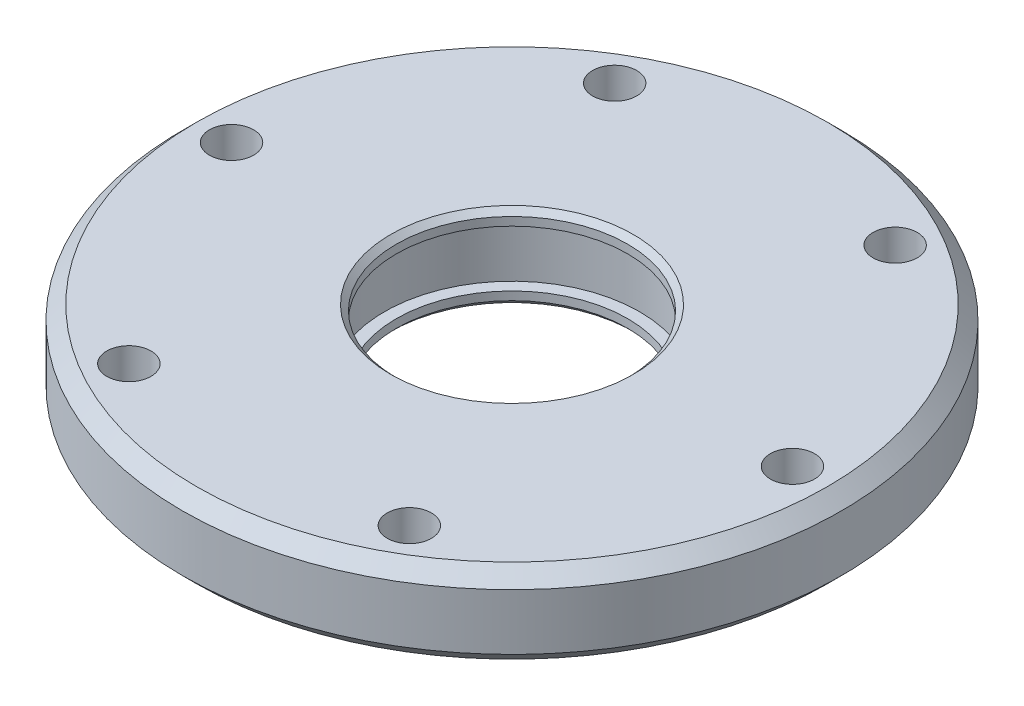
from build123d import *

# Parameters (mm, degrees)
SKETCH1_R           = 23.5
SKETCH1_R_2         = 1.575
SKETCH1_R_3         = 8.25
BOSS_EXTRUDE1_DEPTH = 3
SKETCH2_R           = 9.1
CUT_EXTRUDE1_DEPTH  = 2
SKETCH3_R           = 21.575
SKETCH3_R_2         = 18.425
BOSS_EXTRUDE2_DEPTH = 1
CHAMFER1_SIZE       = 1
CHAMFER2_SIZE       = 0.4


with BuildPart() as part:
    # Sketch1 → Boss-Extrude1 (new, symmetric)
    with BuildSketch(Plane(origin=(0, 0, 0), x_dir=(1, 0, 0), z_dir=(0, 1, 0))):
        Circle(SKETCH1_R)
        with Locations((20, 0)):
            Circle(SKETCH1_R_2, mode=Mode.SUBTRACT)
        with Locations((10, -17.320508076)):
            Circle(SKETCH1_R_2, mode=Mode.SUBTRACT)
        with Locations((-10, -17.320508076)):
            Circle(SKETCH1_R_2, mode=Mode.SUBTRACT)
        with Locations((-20, 0)):
            Circle(SKETCH1_R_2, mode=Mode.SUBTRACT)
        with Locations((-10, 17.320508076)):
            Circle(SKETCH1_R_2, mode=Mode.SUBTRACT)
        with Locations((10, 17.320508076)):
            Circle(SKETCH1_R_2, mode=Mode.SUBTRACT)
        Circle(SKETCH1_R_3, mode=Mode.SUBTRACT)
    extrude(amount=BOSS_EXTRUDE1_DEPTH, both=True)

    # Sketch2 → Cut-Extrude1 (cut, symmetric)
    with BuildSketch(Plane(origin=(0, 0, 0), x_dir=(1, 0, 0), z_dir=(0, 1, 0))):
        Circle(SKETCH2_R)
    extrude(amount=CUT_EXTRUDE1_DEPTH, both=True, mode=Mode.SUBTRACT)

    # Sketch3 → Boss-Extrude2 (add)
    with BuildSketch(Plane(origin=(0, -3, 0), x_dir=(1, 0, 0), z_dir=(0, 1, 0))):
        Circle(SKETCH3_R)
        Circle(SKETCH3_R_2, mode=Mode.SUBTRACT)
    extrude(amount=BOSS_EXTRUDE2_DEPTH)

    # Chamfer1
    chamfer1_edges = [part.edges().sort_by_distance(p)[0] for p in [
        (-23.5, -3, 0),
        (-23.5, 3, 0),
    ]]
    chamfer(chamfer1_edges, length=CHAMFER1_SIZE)

    # Chamfer2
    chamfer2_edges = [part.edges().sort_by_distance(p)[0] for p in [
        (-8.25, -3, 0),
        (-8.25, 3, 0),
    ]]
    chamfer(chamfer2_edges, length=CHAMFER2_SIZE)


solid = part.part
